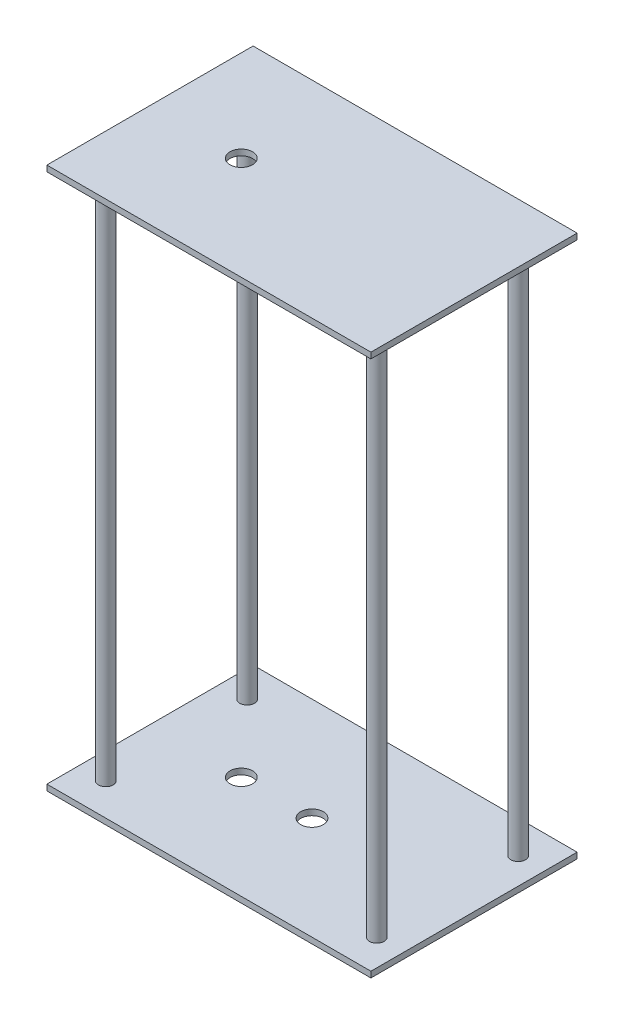
from build123d import *

# Parameters (mm, degrees)
SKETCH1_W           = 550
SKETCH1_H           = 350
BOSS_EXTRUDE1_DEPTH = 10
SKETCH2_R           = 12.5
BOSS_EXTRUDE2_DEPTH = 900
BOSS_EXTRUDE3_START = 910
SKETCH1_2_W         = 550
SKETCH1_2_H         = 350
BOSS_EXTRUDE3_DEPTH = 10
CUT_EXTRUDE1_START  = -920
SKETCH3_R           = 19.15
CUT_EXTRUDE1_DEPTH  = 10
LPATTERN1_COUNT     = 2
LPATTERN1_PITCH     = 120
MIRROR1_START       = 910
MIRROR1_OUTLINE_R   = 19.15
MIRROR1_DEPTH       = 10


# Read off the part's stored shape, not the designer's step: Mirror1
with BuildPart() as part:
    # Sketch1 → Boss-Extrude1 (new body)
    with BuildSketch(Plane(origin=(0, 0, 0), x_dir=(1, 0, 0), z_dir=(0, 1, 0))):
        Rectangle(SKETCH1_W, SKETCH1_H)
    extrude(amount=BOSS_EXTRUDE1_DEPTH)

    # Sketch2 → Boss-Extrude2 (add)
    with BuildSketch(Plane(origin=(0, 10, 0), x_dir=(1, 0, 0), z_dir=(0, 1, 0))):
        with Locations(Location((-230, 120, 0), (0, 0, 270))):
            Circle(SKETCH2_R)
        with Locations(Location((-230, -120, 0), (0, 0, 270))):
            Circle(SKETCH2_R)
        with Locations(Location((230, -120, 0), (0, 0, 270))):
            Circle(SKETCH2_R)
        with Locations(Location((230, 120, 0), (0, 0, 270))):
            Circle(SKETCH2_R)
    extrude(amount=BOSS_EXTRUDE2_DEPTH)

    # Sketch1<2> → Boss-Extrude3 (add)
    with BuildSketch(Plane(origin=(0, 0, 0), x_dir=(1, 0, 0), z_dir=(0, 1, 0)).offset(BOSS_EXTRUDE3_START)):
        Rectangle(SKETCH1_2_W, SKETCH1_2_H)
    extrude(amount=BOSS_EXTRUDE3_DEPTH)

    # Sketch3 → Cut-Extrude1 (cut)
    with BuildSketch(Plane(origin=(0, 920, 0), x_dir=(1, 0, 0), z_dir=(0, 1, 0)).offset(CUT_EXTRUDE1_START)):
        with Locations(Location((-120, 0, 0), (0, 0, 270))):
            Circle(SKETCH3_R)
    cut_extrude1 = extrude(amount=CUT_EXTRUDE1_DEPTH, mode=Mode.SUBTRACT)

    # LPattern1: Cut-Extrude1 ×2
    with Locations(*[(i * LPATTERN1_PITCH, 0, 0) for i in range(1, LPATTERN1_COUNT)]):
        add(cut_extrude1, mode=Mode.SUBTRACT)

    # Mirror1 outline → Mirror1 (cut)
    with BuildSketch(Plane(origin=(0, 0, 0), x_dir=(1, 0, 0), z_dir=(0, 1, 0)).offset(MIRROR1_START)):
        with Locations((-120, 0)):
            Circle(MIRROR1_OUTLINE_R)
    extrude(amount=MIRROR1_DEPTH, mode=Mode.SUBTRACT)


solid = part.part
